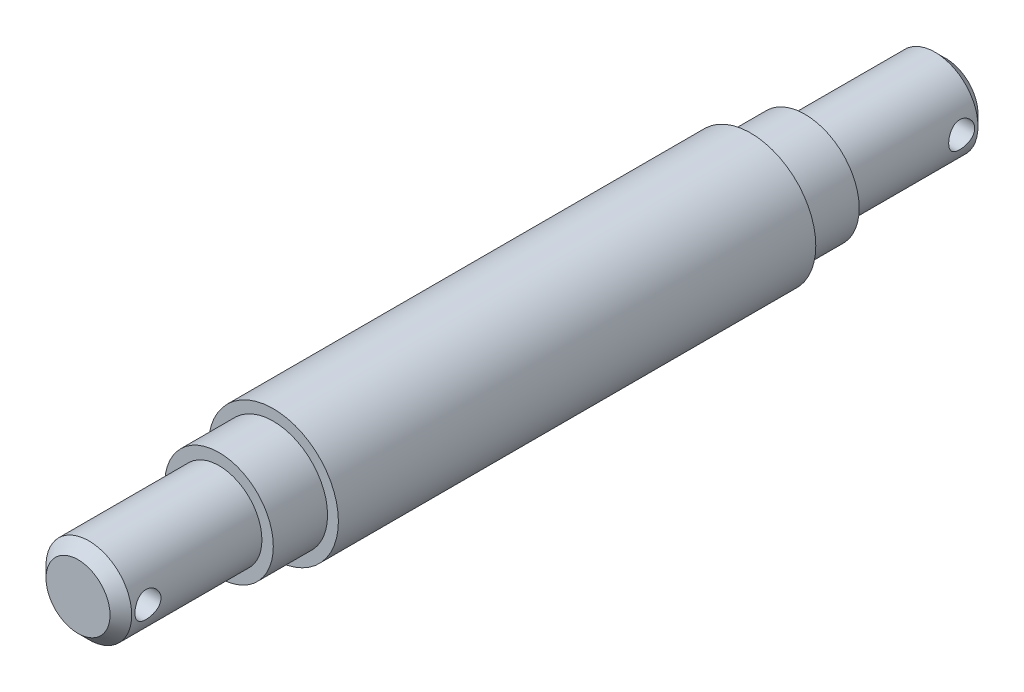
from build123d import *

# Parameters (mm, degrees)
SKETCH1_R           = 6
BOSS_EXTRUDE1_DEPTH = 22
SKETCH2_R           = 5
BOSS_EXTRUDE2_DEPTH = 5
SKETCH3_R           = 3.95
BOSS_EXTRUDE3_DEPTH = 13
SKETCH4_R           = 1.2
CUT_EXTRUDE1_DEPTH  = 6.5
CHAMFER1_SIZE       = 1
CHAMFER2_SIZE       = 1


with BuildPart() as part:
    # Sketch1 → Boss-Extrude1 (new, symmetric)
    with BuildSketch(Plane.XY):
        Circle(SKETCH1_R)
    extrude(amount=BOSS_EXTRUDE1_DEPTH, both=True)

    # Sketch2 → Boss-Extrude2 (add)
    with BuildSketch(Plane.XY.offset(22)):
        Circle(SKETCH2_R)
    boss_extrude2 = extrude(amount=BOSS_EXTRUDE2_DEPTH)

    # Sketch3 → Boss-Extrude3 (add)
    with BuildSketch(Plane.XY.offset(27)):
        Circle(SKETCH3_R)
    boss_extrude3 = extrude(amount=BOSS_EXTRUDE3_DEPTH)

    # Sketch4 → Cut-Extrude1 (cut, symmetric)
    with BuildSketch(Plane(origin=(0, 0, 0), x_dir=(0, 0, -1), z_dir=(1, 0, 0))):
        with Locations((-37.5, 0)):
            Circle(SKETCH4_R)
    cut_extrude1 = extrude(amount=CUT_EXTRUDE1_DEPTH, both=True, mode=Mode.SUBTRACT)

    # Chamfer1
    chamfer1_edges = [part.edges().sort_by_distance(p)[0] for p in [
        (-3.95, 0, 40),
    ]]
    chamfer(chamfer1_edges, length=CHAMFER1_SIZE)

    # Mirror1: Boss-Extrude2, Boss-Extrude3 across plane
    add(boss_extrude2.mirror(Plane.XY))
    add(boss_extrude3.mirror(Plane.XY))

    # Mirror2: Cut-Extrude1 across plane
    add(cut_extrude1.mirror(Plane.XY), mode=Mode.SUBTRACT)

    # Chamfer2
    chamfer2_edges = [part.edges().sort_by_distance(p)[0] for p in [
        (-3.95, 0, -40),
    ]]
    chamfer(chamfer2_edges, length=CHAMFER2_SIZE)


solid = part.part
